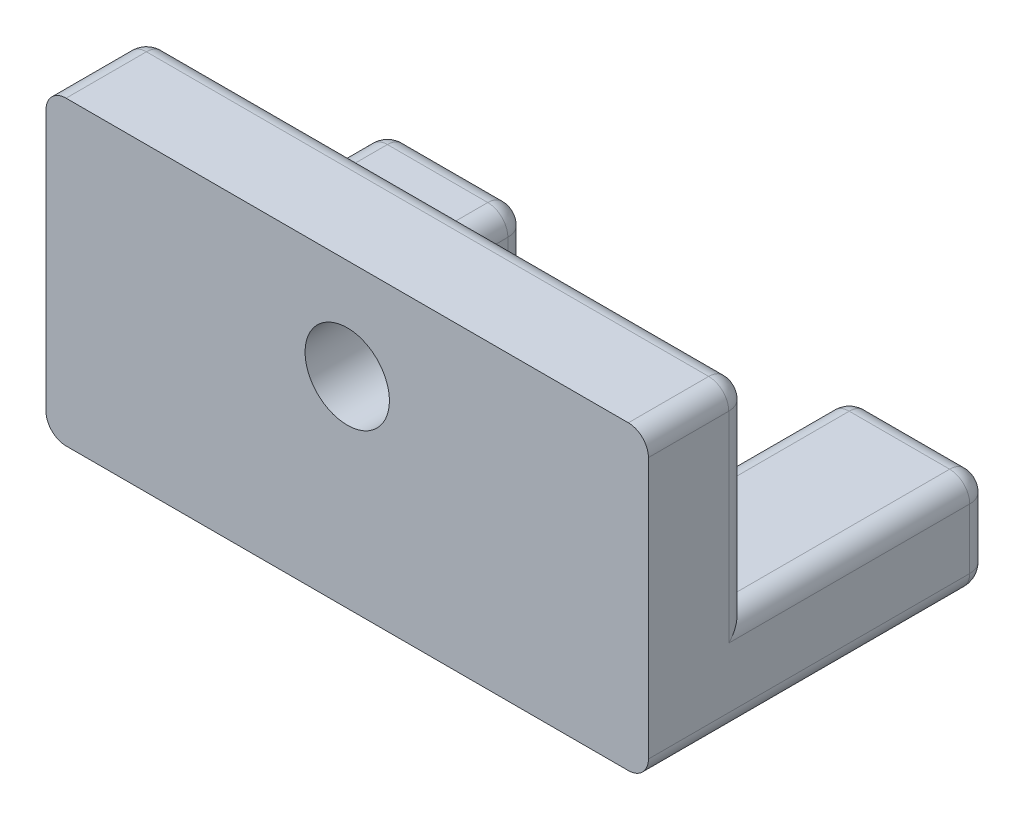
from build123d import *

# Parameters (mm, degrees)
Y_KSEKLIK_EKSTR_ZYON1_DEPTH = 5
IZIM2_W                     = 5
IZIM2_H                     = 10
Y_KSEKLIK_EKSTR_ZYON2_DEPTH = 30
IZIM3_R                     = 2.1
KES_EKSTR_ZYON3_DEPTH       = 5
IZIM4_R                     = 4.5
KES_EKSTR_ZYON4_DEPTH       = 2
RADYUS1_R                   = 1


with BuildPart() as part:
    # Çizim1 → Yükseklik-Ekstrüzyon1 (new body)
    with BuildSketch(Plane(origin=(0, 0, 0), x_dir=(1, 0, 0), z_dir=(0, 1, 0))):
        Polygon((0, 17), (0, 0), (30, 0), (30, 17), (23, 17), (23, 10), (7, 10), (7, 17), align=None)
    extrude(amount=Y_KSEKLIK_EKSTR_ZYON1_DEPTH)

    # Çizim2 → Yükseklik-Ekstrüzyon2 (add)
    with BuildSketch(Plane(origin=(30, 0, 0), x_dir=(0, 0, -1), z_dir=(1, 0, 0))):
        with Locations((2.5, 10)):
            Rectangle(IZIM2_W, IZIM2_H)
    extrude(amount=-Y_KSEKLIK_EKSTR_ZYON2_DEPTH)

    # Çizim3 → Kes-Ekstrüzyon3 (cut)
    with BuildSketch(Plane(origin=(0, 0, -5), x_dir=(-1, 0, 0), z_dir=(0, 0, -1))):
        with Locations((-15, 10)):
            Circle(IZIM3_R)
    extrude(amount=-KES_EKSTR_ZYON3_DEPTH, mode=Mode.SUBTRACT)

    # Çizim4 → Kes-Ekstrüzyon4 (cut)
    with BuildSketch(Plane(origin=(0, 0, -5), x_dir=(-1, 0, 0), z_dir=(0, 0, -1))):
        with Locations((-15, 10)):
            Circle(IZIM4_R)
    extrude(amount=-KES_EKSTR_ZYON4_DEPTH, mode=Mode.SUBTRACT)

    # Radyus1
    # the kernel refuses this fillet: 1 mm, written as the material it takes off along each edge
    with BuildSketch(Plane(origin=(1, 4, -16), x_dir=(0, 0, -1), z_dir=(-1, 0, 0))) as radyus1_piece_1_section:
        Polygon((0, 0), (RADYUS1_R, 0), (RADYUS1_R, -RADYUS1_R), (0, -RADYUS1_R), align=None)
    radyus1_piece_1 = extrude(amount=RADYUS1_R, mode=Mode.PRIVATE)
    radyus1_piece_1 = radyus1_piece_1 - Plane(origin=(1, 4, -16), x_dir=(0, -0.7071067811865475, 0.7071067811865475), z_dir=(-1, 0, 0)) * Sphere(RADYUS1_R, mode=Mode.PRIVATE)
    add(radyus1_piece_1, mode=Mode.SUBTRACT)
    with BuildSketch(Plane(origin=(24, 4, -16), x_dir=(0, 1, 0), z_dir=(-1, 0, 0))) as radyus1_piece_2_section:
        Polygon((0, 0), (RADYUS1_R, 0), (RADYUS1_R, RADYUS1_R), (0, RADYUS1_R), align=None)
    radyus1_piece_2 = extrude(amount=RADYUS1_R, mode=Mode.PRIVATE)
    radyus1_piece_2 = radyus1_piece_2 - Plane(origin=(24, 4, -16), x_dir=(0, -0.7071067811865475, 0.7071067811865475), z_dir=(-1, 0, 0)) * Sphere(RADYUS1_R, mode=Mode.PRIVATE)
    add(radyus1_piece_2, mode=Mode.SUBTRACT)
    with BuildSketch(Plane(origin=(29, 14, -4), x_dir=(0, 0, -1), z_dir=(1, 0, 0))) as radyus1_piece_3_section:
        Polygon((0, 0), (RADYUS1_R, 0), (RADYUS1_R, RADYUS1_R), (0, RADYUS1_R), align=None)
    radyus1_piece_3 = extrude(amount=RADYUS1_R, mode=Mode.PRIVATE)
    radyus1_piece_3 = radyus1_piece_3 - Plane(origin=(29, 14, -4), x_dir=(0, -0.7071067811865475, 0.7071067811865475), z_dir=(1, 0, 0)) * Sphere(RADYUS1_R, mode=Mode.PRIVATE)
    add(radyus1_piece_3, mode=Mode.SUBTRACT)
    with BuildSketch(Plane(origin=(1, 14, -4), x_dir=(0, 0, -1), z_dir=(-1, 0, 0))) as radyus1_piece_4_section:
        Polygon((0, 0), (RADYUS1_R, 0), (RADYUS1_R, -RADYUS1_R), (0, -RADYUS1_R), align=None)
    radyus1_piece_4 = extrude(amount=RADYUS1_R, mode=Mode.PRIVATE)
    radyus1_piece_4 = radyus1_piece_4 - Plane(origin=(1, 14, -4), x_dir=(0, -0.7071067811865475, 0.7071067811865475), z_dir=(-1, 0, 0)) * Sphere(RADYUS1_R, mode=Mode.PRIVATE)
    add(radyus1_piece_4, mode=Mode.SUBTRACT)
    with BuildSketch(Plane(origin=(29, 4, -16), x_dir=(0, 1, 0), z_dir=(0, 0, -1))) as radyus1_piece_5_section:
        Polygon((0, 0), (RADYUS1_R, 0), (RADYUS1_R, RADYUS1_R), (0, RADYUS1_R), align=None)
    radyus1_piece_5 = extrude(amount=RADYUS1_R, mode=Mode.PRIVATE)
    radyus1_piece_5 = radyus1_piece_5 - Plane(origin=(29, 4, -16), x_dir=(-0.7071067811865475, -0.7071067811865475, 0), z_dir=(0, 0, -1)) * Sphere(RADYUS1_R, mode=Mode.PRIVATE)
    add(radyus1_piece_5, mode=Mode.SUBTRACT)
    with BuildSketch(Plane(origin=(29, 1, -16), x_dir=(1, 0, 0), z_dir=(0, 0, -1))) as radyus1_piece_6_section:
        Polygon((0, 0), (RADYUS1_R, 0), (RADYUS1_R, RADYUS1_R), (0, RADYUS1_R), align=None)
    radyus1_piece_6 = extrude(amount=RADYUS1_R, mode=Mode.PRIVATE)
    radyus1_piece_6 = radyus1_piece_6 - Plane(origin=(29, 1, -16), x_dir=(-0.7071067811865475, 0.7071067811865475, 0), z_dir=(0, 0, -1)) * Sphere(RADYUS1_R, mode=Mode.PRIVATE)
    add(radyus1_piece_6, mode=Mode.SUBTRACT)
    with BuildSketch(Plane(origin=(24, 1, -16), x_dir=(0, 0, -1), z_dir=(-1, 0, 0))) as radyus1_piece_7_section:
        Polygon((0, 0), (RADYUS1_R, 0), (RADYUS1_R, RADYUS1_R), (0, RADYUS1_R), align=None)
    radyus1_piece_7 = extrude(amount=RADYUS1_R, mode=Mode.PRIVATE)
    radyus1_piece_7 = radyus1_piece_7 - Plane(origin=(24, 1, -16), x_dir=(0, 0.7071067811865475, 0.7071067811865475), z_dir=(-1, 0, 0)) * Sphere(RADYUS1_R, mode=Mode.PRIVATE)
    add(radyus1_piece_7, mode=Mode.SUBTRACT)
    with BuildSketch(Plane(origin=(6, 4, -16), x_dir=(0, 1, 0), z_dir=(0, 0, -1))) as radyus1_piece_8_section:
        Polygon((0, 0), (RADYUS1_R, 0), (RADYUS1_R, RADYUS1_R), (0, RADYUS1_R), align=None)
    radyus1_piece_8 = extrude(amount=RADYUS1_R, mode=Mode.PRIVATE)
    radyus1_piece_8 = radyus1_piece_8 - Plane(origin=(6, 4, -16), x_dir=(-0.7071067811865475, -0.7071067811865475, 0), z_dir=(0, 0, -1)) * Sphere(RADYUS1_R, mode=Mode.PRIVATE)
    add(radyus1_piece_8, mode=Mode.SUBTRACT)
    with BuildSketch(Plane(origin=(1, 1, -16), x_dir=(0, 0, -1), z_dir=(-1, 0, 0))) as radyus1_piece_9_section:
        Polygon((0, 0), (RADYUS1_R, 0), (RADYUS1_R, RADYUS1_R), (0, RADYUS1_R), align=None)
    radyus1_piece_9 = extrude(amount=RADYUS1_R, mode=Mode.PRIVATE)
    radyus1_piece_9 = radyus1_piece_9 - Plane(origin=(1, 1, -16), x_dir=(0, 0.7071067811865475, 0.7071067811865475), z_dir=(-1, 0, 0)) * Sphere(RADYUS1_R, mode=Mode.PRIVATE)
    add(radyus1_piece_9, mode=Mode.SUBTRACT)
    with BuildSketch(Plane(origin=(6, 1, -16), x_dir=(0, -1, 0), z_dir=(0, 0, -1))) as radyus1_piece_10_section:
        Polygon((0, 0), (RADYUS1_R, 0), (RADYUS1_R, -RADYUS1_R), (0, -RADYUS1_R), align=None)
    radyus1_piece_10 = extrude(amount=RADYUS1_R, mode=Mode.PRIVATE)
    radyus1_piece_10 = radyus1_piece_10 - Plane(origin=(6, 1, -16), x_dir=(-0.7071067811865475, 0.7071067811865475, 0), z_dir=(0, 0, -1)) * Sphere(RADYUS1_R, mode=Mode.PRIVATE)
    add(radyus1_piece_10, mode=Mode.SUBTRACT)
    with BuildSketch(Plane(origin=(0, 5, -16), x_dir=(0, -1, 0), z_dir=(0, 0, 1))) as radyus1_piece_11:
        with BuildLine():
            CenterArc((RADYUS1_R, RADYUS1_R), RADYUS1_R, 180, 90)
            Line((0, RADYUS1_R), (0, 0))
            Line((0, 0), (RADYUS1_R, 0))
        make_face()
    extrude(amount=11, mode=Mode.SUBTRACT)
    with BuildSketch(Plane(origin=(23, 5, -16), x_dir=(1, 0, 0), z_dir=(0, 0, 1)), Plane(origin=(7, 5, -10), x_dir=(-1, 0, 0), z_dir=(0, 0, -1))) as radyus1_piece_12:
        with BuildLine():
            CenterArc((RADYUS1_R, -RADYUS1_R), RADYUS1_R, 90, 90)
            Line((0, -RADYUS1_R), (0, 0))
            Line((0, 0), (RADYUS1_R, 0))
        make_face()
    extrude(amount=6, mode=Mode.SUBTRACT)
    with BuildSketch(Plane(origin=(30, 5, -5), x_dir=(-1, 0, 0), z_dir=(0, 1, 0)), Plane(origin=(0, 5, -5), x_dir=(0, 0, 1), z_dir=(0, 1, 0))) as radyus1_piece_13:
        with BuildLine():
            CenterArc((RADYUS1_R, RADYUS1_R), RADYUS1_R, 180, 90)
            Line((0, RADYUS1_R), (0, 0))
            Line((0, 0), (RADYUS1_R, 0))
        make_face()
    extrude(amount=9, mode=Mode.SUBTRACT)
    with BuildSketch(Plane(origin=(29, 15, -5), x_dir=(0, -1, 0), z_dir=(-1, 0, 0))) as radyus1_piece_14:
        with BuildLine():
            CenterArc((RADYUS1_R, RADYUS1_R), RADYUS1_R, 180, 90)
            Line((0, RADYUS1_R), (0, 0))
            Line((0, 0), (RADYUS1_R, 0))
        make_face()
    extrude(amount=28, mode=Mode.SUBTRACT)
    with BuildSketch(Plane(origin=(30, 5, -5), x_dir=(-1, 0, 0), z_dir=(0, 0, -1))) as radyus1_piece_15:
        with BuildLine():
            CenterArc((RADYUS1_R, -RADYUS1_R), RADYUS1_R, 90, 90)
            Line((0, -RADYUS1_R), (0, 0))
            Line((0, 0), (RADYUS1_R, 0))
        make_face()
    extrude(amount=11, mode=Mode.SUBTRACT)
    with BuildSketch(Plane(origin=(30, 1, -17), x_dir=(-1, 0, 0), z_dir=(0, 1, 0)), Plane(origin=(23, 1, -17), x_dir=(0, 0, 1), z_dir=(0, 1, 0)), Plane(origin=(0, 1, -17), x_dir=(0, 0, 1), z_dir=(0, 1, 0)), Plane(origin=(7, 1, -17), x_dir=(-1, 0, 0), z_dir=(0, 1, 0))) as radyus1_piece_16:
        with BuildLine():
            CenterArc((RADYUS1_R, RADYUS1_R), RADYUS1_R, 180, 90)
            Line((0, RADYUS1_R), (0, 0))
            Line((0, 0), (RADYUS1_R, 0))
        make_face()
    extrude(amount=3, mode=Mode.SUBTRACT)
    with BuildSketch(Plane(origin=(29, 5, -17), x_dir=(0, 0, 1), z_dir=(-1, 0, 0)), Plane(origin=(6, 0, -17), x_dir=(0, 1, 0), z_dir=(-1, 0, 0))) as radyus1_piece_17:
        with BuildLine():
            CenterArc((RADYUS1_R, -RADYUS1_R), RADYUS1_R, 90, 90)
            Line((0, -RADYUS1_R), (0, 0))
            Line((0, 0), (RADYUS1_R, 0))
        make_face()
    extrude(amount=5, mode=Mode.SUBTRACT)
    with BuildSketch(Plane(origin=(23, 5, -10), x_dir=(0, 0, 1), z_dir=(-1, 0, 0))) as radyus1_piece_18:
        with BuildLine():
            CenterArc((RADYUS1_R, -RADYUS1_R), RADYUS1_R, 90, 90)
            Line((0, -RADYUS1_R), (0, 0))
            Line((0, 0), (RADYUS1_R, 0))
        make_face()
    extrude(amount=16, mode=Mode.SUBTRACT)
    with BuildSketch(Plane(origin=(6, 5, -17), x_dir=(0, -1, 0), z_dir=(-1, 0, 0)), Plane(origin=(29, 0, -17), x_dir=(0, 0, 1), z_dir=(-1, 0, 0))) as radyus1_piece_19:
        with BuildLine():
            CenterArc((RADYUS1_R, RADYUS1_R), RADYUS1_R, 180, 90)
            Line((0, RADYUS1_R), (0, 0))
            Line((0, 0), (RADYUS1_R, 0))
        make_face()
    extrude(amount=5, mode=Mode.SUBTRACT)
    with BuildSketch(Plane(origin=(0, 0, -16), x_dir=(0, 1, 0), z_dir=(0, 0, 1))) as radyus1_piece_20:
        with BuildLine():
            CenterArc((RADYUS1_R, -RADYUS1_R), RADYUS1_R, 90, 90)
            Line((0, -RADYUS1_R), (0, 0))
            Line((0, 0), (RADYUS1_R, 0))
        make_face()
    extrude(amount=18.5, mode=Mode.SUBTRACT)
    with BuildSketch(Plane(origin=(7, 0, -10), x_dir=(-1, 0, 0), z_dir=(0, 0, -1)), Plane(origin=(23, 0, -16), x_dir=(1, 0, 0), z_dir=(0, 0, 1))) as radyus1_piece_21:
        with BuildLine():
            CenterArc((RADYUS1_R, RADYUS1_R), RADYUS1_R, 180, 90)
            Line((0, RADYUS1_R), (0, 0))
            Line((0, 0), (RADYUS1_R, 0))
        make_face()
    extrude(amount=6, mode=Mode.SUBTRACT)
    with BuildSketch(Plane(origin=(23, 0, -10), x_dir=(0, 0, 1), z_dir=(-1, 0, 0))) as radyus1_piece_22:
        with BuildLine():
            CenterArc((RADYUS1_R, RADYUS1_R), RADYUS1_R, 180, 90)
            Line((0, RADYUS1_R), (0, 0))
            Line((0, 0), (RADYUS1_R, 0))
        make_face()
    extrude(amount=16, mode=Mode.SUBTRACT)
    with BuildSketch(Plane(origin=(30, 0, 2.5), x_dir=(-1, 0, 0), z_dir=(0, 0, -1))) as radyus1_piece_23:
        with BuildLine():
            CenterArc((RADYUS1_R, RADYUS1_R), RADYUS1_R, 180, 90)
            Line((0, RADYUS1_R), (0, 0))
            Line((0, 0), (RADYUS1_R, 0))
        make_face()
    extrude(amount=18.5, mode=Mode.SUBTRACT)
    with BuildSketch(Plane(origin=(30, 15, -4), x_dir=(-1, 0, 0), z_dir=(0, 0, 1)), Plane(origin=(0, 15, -4), x_dir=(0, -1, 0), z_dir=(0, 0, 1))) as radyus1_piece_24:
        with BuildLine():
            CenterArc((RADYUS1_R, RADYUS1_R), RADYUS1_R, 180, 90)
            Line((0, RADYUS1_R), (0, 0))
            Line((0, 0), (RADYUS1_R, 0))
        make_face()
    extrude(amount=6.5, mode=Mode.SUBTRACT)
    with BuildSketch(Plane(origin=(0, 5, -16), x_dir=(0, -1, 0), z_dir=(0, 0, 1))) as radyus1_piece_25a_section:
        with BuildLine():
            CenterArc((RADYUS1_R, RADYUS1_R), RADYUS1_R, 180, 90)
            Line((0, RADYUS1_R), (0, 0))
            Line((0, 0), (RADYUS1_R, 0))
        make_face()
    radyus1_piece_25a = extrude(amount=13.5, mode=Mode.PRIVATE)
    radyus1_piece_25a = split(radyus1_piece_25a, bisect_by=Plane(origin=(0.226395114, 4.773604886, -5), z_dir=(0, 0, 1)), keep=Keep.TOP, mode=Mode.PRIVATE)
    with BuildSketch(Plane(origin=(0, 2.5, -5), x_dir=(0, 0, 1), z_dir=(0, 1, 0))) as radyus1_piece_25b_section:
        with BuildLine():
            CenterArc((RADYUS1_R, RADYUS1_R), RADYUS1_R, 180, 90)
            Line((0, RADYUS1_R), (0, 0))
            Line((0, 0), (RADYUS1_R, 0))
        make_face()
    radyus1_piece_25b = extrude(amount=11.5, mode=Mode.PRIVATE)
    radyus1_piece_25b = split(radyus1_piece_25b, bisect_by=Plane(origin=(0.226395114, 5, -4.773604886), z_dir=(0, -1, 0)), keep=Keep.TOP, mode=Mode.PRIVATE)
    radyus1_piece_25 = radyus1_piece_25a & radyus1_piece_25b
    add(radyus1_piece_25, mode=Mode.SUBTRACT)
    with BuildSketch(Plane(origin=(25.5, 5, -10), x_dir=(0, 0, 1), z_dir=(-1, 0, 0))) as radyus1_piece_26a_section:
        with BuildLine():
            CenterArc((RADYUS1_R, -RADYUS1_R), RADYUS1_R, 90, 90)
            Line((0, -RADYUS1_R), (0, 0))
            Line((0, 0), (RADYUS1_R, 0))
        make_face()
    radyus1_piece_26a = extrude(amount=18.5, mode=Mode.PRIVATE)
    radyus1_piece_26a = split(radyus1_piece_26a, bisect_by=Plane(origin=(23, 4.773604886, -9.773604886), z_dir=(1, 0, 0)), keep=Keep.TOP, mode=Mode.PRIVATE)
    with BuildSketch(Plane(origin=(23, 5, -16), x_dir=(1, 0, 0), z_dir=(0, 0, 1))) as radyus1_piece_26b_section:
        with BuildLine():
            CenterArc((RADYUS1_R, -RADYUS1_R), RADYUS1_R, 90, 90)
            Line((0, -RADYUS1_R), (0, 0))
            Line((0, 0), (RADYUS1_R, 0))
        make_face()
    radyus1_piece_26b = extrude(amount=8.5, mode=Mode.PRIVATE)
    radyus1_piece_26b = split(radyus1_piece_26b, bisect_by=Plane(origin=(23.226395114, 4.773604886, -10), z_dir=(0, 0, 1)), keep=Keep.TOP, mode=Mode.PRIVATE)
    radyus1_piece_26 = radyus1_piece_26a & radyus1_piece_26b
    add(radyus1_piece_26, mode=Mode.SUBTRACT)
    with BuildSketch(Plane(origin=(30, 5, -2.5), x_dir=(-1, 0, 0), z_dir=(0, 0, -1))) as radyus1_piece_27a_section:
        with BuildLine():
            CenterArc((RADYUS1_R, -RADYUS1_R), RADYUS1_R, 90, 90)
            Line((0, -RADYUS1_R), (0, 0))
            Line((0, 0), (RADYUS1_R, 0))
        make_face()
    radyus1_piece_27a = extrude(amount=13.5, mode=Mode.PRIVATE)
    radyus1_piece_27a = split(radyus1_piece_27a, bisect_by=Plane(origin=(29.773604886, 4.773604886, -5), z_dir=(0, 0, 1)), keep=Keep.TOP, mode=Mode.PRIVATE)
    with BuildSketch(Plane(origin=(30, 2.5, -5), x_dir=(-1, 0, 0), z_dir=(0, 1, 0))) as radyus1_piece_27b_section:
        with BuildLine():
            CenterArc((RADYUS1_R, RADYUS1_R), RADYUS1_R, 180, 90)
            Line((0, RADYUS1_R), (0, 0))
            Line((0, 0), (RADYUS1_R, 0))
        make_face()
    radyus1_piece_27b = extrude(amount=11.5, mode=Mode.PRIVATE)
    radyus1_piece_27b = split(radyus1_piece_27b, bisect_by=Plane(origin=(29.773604886, 5, -4.773604886), z_dir=(0, -1, 0)), keep=Keep.TOP, mode=Mode.PRIVATE)
    radyus1_piece_27 = radyus1_piece_27a & radyus1_piece_27b
    add(radyus1_piece_27, mode=Mode.SUBTRACT)
    with BuildSketch(Plane(origin=(7, 5, -7.5), x_dir=(-1, 0, 0), z_dir=(0, 0, -1))) as radyus1_piece_28a_section:
        with BuildLine():
            CenterArc((RADYUS1_R, -RADYUS1_R), RADYUS1_R, 90, 90)
            Line((0, -RADYUS1_R), (0, 0))
            Line((0, 0), (RADYUS1_R, 0))
        make_face()
    radyus1_piece_28a = extrude(amount=8.5, mode=Mode.PRIVATE)
    radyus1_piece_28a = split(radyus1_piece_28a, bisect_by=Plane(origin=(6.773604886, 4.773604886, -10), z_dir=(0, 0, 1)), keep=Keep.TOP, mode=Mode.PRIVATE)
    with BuildSketch(Plane(origin=(23, 5, -10), x_dir=(0, 0, 1), z_dir=(-1, 0, 0))) as radyus1_piece_28b_section:
        with BuildLine():
            CenterArc((RADYUS1_R, -RADYUS1_R), RADYUS1_R, 90, 90)
            Line((0, -RADYUS1_R), (0, 0))
            Line((0, 0), (RADYUS1_R, 0))
        make_face()
    radyus1_piece_28b = extrude(amount=18.5, mode=Mode.PRIVATE)
    radyus1_piece_28b = split(radyus1_piece_28b, bisect_by=Plane(origin=(7, 4.773604886, -9.773604886), z_dir=(-1, 0, 0)), keep=Keep.TOP, mode=Mode.PRIVATE)
    radyus1_piece_28 = radyus1_piece_28a & radyus1_piece_28b
    add(radyus1_piece_28, mode=Mode.SUBTRACT)
    with BuildSketch(Plane(origin=(23, 0, -10), x_dir=(0, 0, 1), z_dir=(-1, 0, 0))) as radyus1_piece_29a_section:
        with BuildLine():
            CenterArc((RADYUS1_R, RADYUS1_R), RADYUS1_R, 180, 90)
            Line((0, RADYUS1_R), (0, 0))
            Line((0, 0), (RADYUS1_R, 0))
        make_face()
    radyus1_piece_29a = extrude(amount=18.5, mode=Mode.PRIVATE)
    radyus1_piece_29a = split(radyus1_piece_29a, bisect_by=Plane(origin=(7, 0.226395114, -9.773604886), z_dir=(-1, 0, 0)), keep=Keep.TOP, mode=Mode.PRIVATE)
    with BuildSketch(Plane(origin=(7, 0, -7.5), x_dir=(-1, 0, 0), z_dir=(0, 0, -1))) as radyus1_piece_29b_section:
        with BuildLine():
            CenterArc((RADYUS1_R, RADYUS1_R), RADYUS1_R, 180, 90)
            Line((0, RADYUS1_R), (0, 0))
            Line((0, 0), (RADYUS1_R, 0))
        make_face()
    radyus1_piece_29b = extrude(amount=8.5, mode=Mode.PRIVATE)
    radyus1_piece_29b = split(radyus1_piece_29b, bisect_by=Plane(origin=(6.773604886, 0.226395114, -10), z_dir=(0, 0, 1)), keep=Keep.TOP, mode=Mode.PRIVATE)
    radyus1_piece_29 = radyus1_piece_29a & radyus1_piece_29b
    add(radyus1_piece_29, mode=Mode.SUBTRACT)
    with BuildSketch(Plane(origin=(23, 0, -16), x_dir=(1, 0, 0), z_dir=(0, 0, 1))) as radyus1_piece_30a_section:
        with BuildLine():
            CenterArc((RADYUS1_R, RADYUS1_R), RADYUS1_R, 180, 90)
            Line((0, RADYUS1_R), (0, 0))
            Line((0, 0), (RADYUS1_R, 0))
        make_face()
    radyus1_piece_30a = extrude(amount=8.5, mode=Mode.PRIVATE)
    radyus1_piece_30a = split(radyus1_piece_30a, bisect_by=Plane(origin=(23.226395114, 0.226395114, -10), z_dir=(0, 0, 1)), keep=Keep.TOP, mode=Mode.PRIVATE)
    with BuildSketch(Plane(origin=(25.5, 0, -10), x_dir=(0, 0, 1), z_dir=(-1, 0, 0))) as radyus1_piece_30b_section:
        with BuildLine():
            CenterArc((RADYUS1_R, RADYUS1_R), RADYUS1_R, 180, 90)
            Line((0, RADYUS1_R), (0, 0))
            Line((0, 0), (RADYUS1_R, 0))
        make_face()
    radyus1_piece_30b = extrude(amount=18.5, mode=Mode.PRIVATE)
    radyus1_piece_30b = split(radyus1_piece_30b, bisect_by=Plane(origin=(23, 0.226395114, -9.773604886), z_dir=(1, 0, 0)), keep=Keep.TOP, mode=Mode.PRIVATE)
    radyus1_piece_30 = radyus1_piece_30a & radyus1_piece_30b
    add(radyus1_piece_30, mode=Mode.SUBTRACT)


solid = part.part
